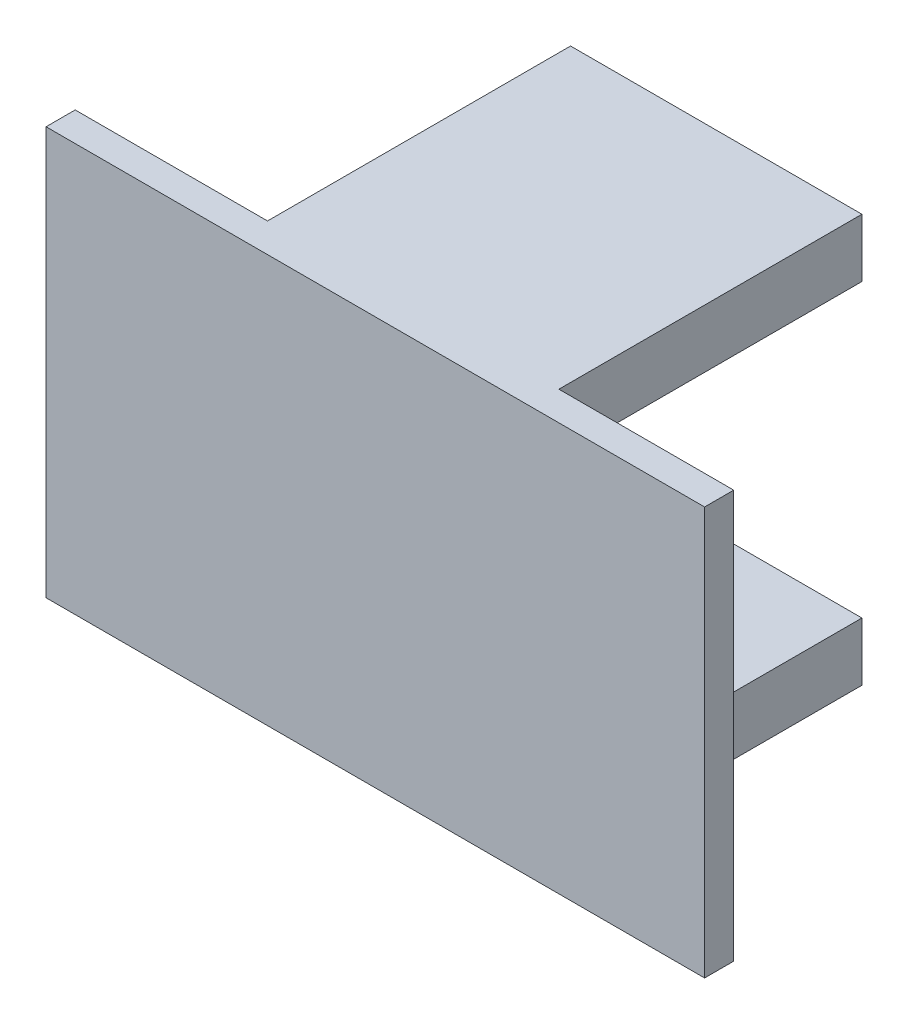
from build123d import *

# Parameters (mm, degrees)
SKETCH_1_W      = 113
SKETCH_1_H      = 70
EXTRUDE_1_DEPTH = 5
SKETCH_2_W      = 50
SKETCH_2_H      = 10
EXTRUDE_2_DEPTH = 52


with BuildPart() as part:
    # 草图1 → 凸台-拉伸1 (new body)
    with BuildSketch(Plane.XY):
        Rectangle(SKETCH_1_W, SKETCH_1_H)
    extrude(amount=EXTRUDE_1_DEPTH)

    # 草图2 → 凸台-拉伸2 (add)
    with BuildSketch(Plane(origin=(0, 0, 0), x_dir=(-1, 0, 0), z_dir=(0, 0, -1))):
        with Locations((-1.5, -30)):
            Rectangle(SKETCH_2_W, SKETCH_2_H)
        with Locations((-1.5, 30)):
            Rectangle(SKETCH_2_W, SKETCH_2_H)
    extrude(amount=EXTRUDE_2_DEPTH)


solid = part.part
